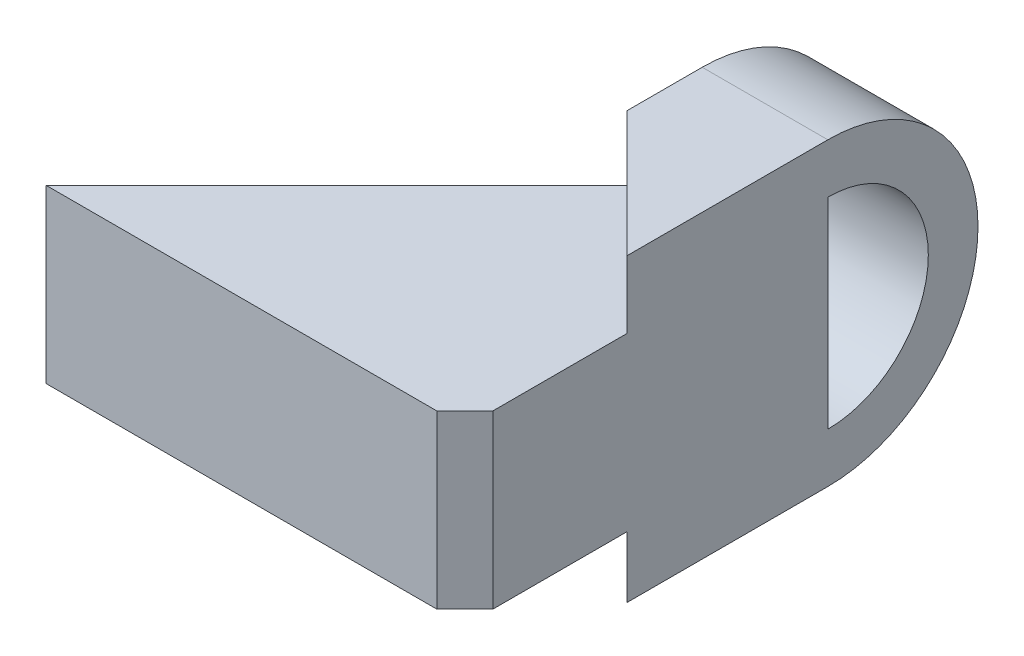
from build123d import *

# Parameters (mm, degrees)
SZKIC1_R                         = 11.955497861
SZKIC1_R_2                       = 8
DODANIE_WYCI_GNI_CIE1_DEPTH      = 10
SZKIC2_W                         = 10
SZKIC2_H                         = 23.910995722
DODANIE_WYCI_GNI_CIE2_DEPTH      = 21
SFAZOWANIE1_SIZE                 = 15
SZKIC4_W                         = 9.112824073
SZKIC4_H                         = 13.669236109
DODANIE_WYCI_GNI_CIE4_DEPTH      = 33
DODANIE_WYCI_GNI_CIE5_DEPTH      = 10
DODANIE_WYCI_GNI_CIE5_DEPTH_BACK = 12
SZKIC5_W                         = 41.411530905
SZKIC5_H                         = 13.669236109
SZKIC6_W                         = 16.08298615
SZKIC6_H                         = 27.20632334
WYTNIJ_WYCI_GNI_CIE1_DEPTH       = 54.798638821
WYTNIJ_WYCI_GNI_CIE2_DEPTH       = 54.798638821


with BuildPart() as part:
    # Szkic1 → Dodanie-wyciągnięcie1 (new body)
    with BuildSketch(Plane(origin=(0, 0, 0), x_dir=(0, 0, -1), z_dir=(1, 0, 0))):
        Circle(SZKIC1_R)
        Circle(SZKIC1_R_2, mode=Mode.SUBTRACT)
    extrude(amount=DODANIE_WYCI_GNI_CIE1_DEPTH)

    # Szkic2 → Dodanie-wyciągnięcie2 (add)
    with BuildSketch(Plane.XY):
        with Locations((5, 0)):
            Rectangle(SZKIC2_W, SZKIC2_H)
    extrude(amount=DODANIE_WYCI_GNI_CIE2_DEPTH)

    # Sfazowanie1
    # the kernel refuses this chamfer: 15 mm, written as the material it takes off along each edge
    with BuildSketch(Plane(origin=(0, -50.53074268, 21), x_dir=(0.9996219169112968, 0, 0.02749587661058632), z_dir=(0, 1, 0))) as sfazowanie1_piece_1:
        Polygon((SFAZOWANIE1_SIZE * 0.999621916911, SFAZOWANIE1_SIZE * 0.0274958766106), (-SFAZOWANIE1_SIZE * 0.0274958766106, SFAZOWANIE1_SIZE * 0.999621916911), (0, 0), align=None)
    extrude(amount=101.06148536, mode=Mode.SUBTRACT)

    # Szkic4 → Dodanie-wyciągnięcie4 (add)
    with BuildSketch(Plane(origin=(-3, 0, 3), x_dir=(0.7071067811865513, 0, 0.7071067811865438), z_dir=(-0.7071067811865438, 0, 0.7071067811865513))):
        with Locations((11.369948619, -0.23897266)):
            Rectangle(SZKIC4_W, SZKIC4_H)
    extrude(amount=DODANIE_WYCI_GNI_CIE4_DEPTH)

    # Szkic5 → Dodanie-wyciągnięcie5 (add, two sides: drawn at the far end of the back side and taken through both)
    with BuildSketch(Plane(origin=(11.261637619, 0, 11.261637619), x_dir=(0.7071067811865438, 0, -0.7071067811865512), z_dir=(0.7071067811865512, 0, 0.7071067811865438)).offset(-DODANIE_WYCI_GNI_CIE5_DEPTH_BACK)):
        with Locations((-16.536875235, -0.23897266)):
            Rectangle(SZKIC5_W, SZKIC5_H)
    extrude(amount=DODANIE_WYCI_GNI_CIE5_DEPTH + DODANIE_WYCI_GNI_CIE5_DEPTH_BACK)

    # Szkic6 → Wytnij-wyciągnięcie1 (cut, through all)
    with BuildSketch(Plane(origin=(0, 6.595645395, 0), x_dir=(1, 0, 0), z_dir=(0, 1, 0))):
        with Locations((18.041493075, -17.707460584)):
            Rectangle(SZKIC6_W, SZKIC6_H)
    extrude(amount=-WYTNIJ_WYCI_GNI_CIE1_DEPTH, mode=Mode.SUBTRACT)

    # Szkic7 → Wytnij-wyciągnięcie2 (cut, through all)
    with BuildSketch(Plane(origin=(0, 6.595645395, 0), x_dir=(1, 0, 0), z_dir=(0, 1, 0))):
        Polygon((-23.770482817, -28.898564741), (9.416159533, -28.898564741), (9.416159533, -47.919361128), (-20.148773981, -47.919361128), align=None)
    extrude(amount=-WYTNIJ_WYCI_GNI_CIE2_DEPTH, mode=Mode.SUBTRACT)


solid = part.part
